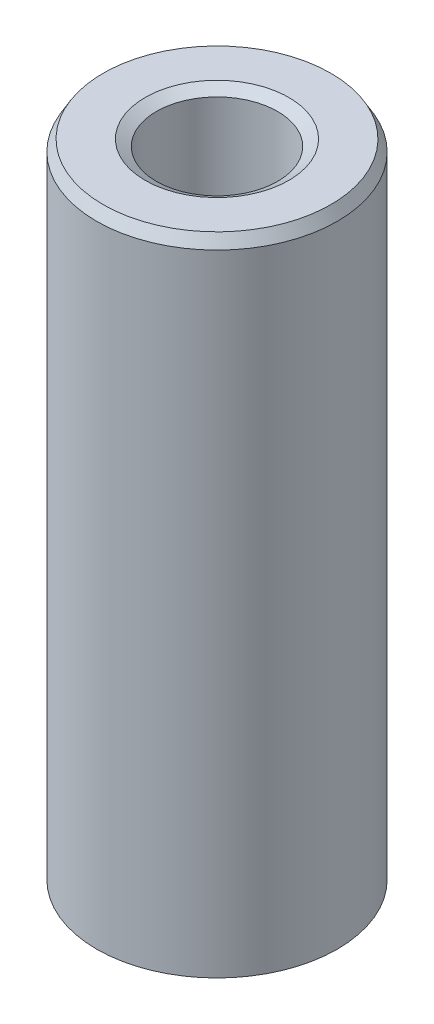
from build123d import *
from OCP.BRepFilletAPI import BRepFilletAPI_MakeChamfer

# Parameters (mm, degrees)
SKETCH1_R           = 10
BOSS_EXTRUDE1_DEPTH = 53.862137515
SKETCH2_R           = 5.038886239
CUT_EXTRUDE1_DEPTH  = 56.687789126
CHAMFER1_SIZE       = 0.932884394
CHAMFER1_SIZE2      = 0.538601056


with BuildPart() as part:
    # Sketch1 → Boss-Extrude1 (new body)
    with BuildSketch(Plane(origin=(0, 0, 0), x_dir=(1, 0, 0), z_dir=(0, 1, 0))):
        Circle(SKETCH1_R)
    extrude(amount=BOSS_EXTRUDE1_DEPTH)

    # Sketch2 → Cut-Extrude1 (cut, through all)
    with BuildSketch(Plane(origin=(0, 0, 0), x_dir=(1, 0, 0), z_dir=(0, 1, 0))):
        Circle(SKETCH2_R)
    extrude(amount=CUT_EXTRUDE1_DEPTH, mode=Mode.SUBTRACT)

    # Chamfer1: one chamfer whose edges measure the first distance from different faces: ONE call of the kernel's chamfer builder (chamfer() names one face for all edges)
    chamfer1_edges_1 = [part.edges().sort_by_distance(p)[0] for p in [
        (-5.038886239, 53.862137515, 0),
    ]]
    chamfer1_side_1 = [part.faces().sort_by_distance(p)[0] for p in [
        (-9.717157288, 53.862137515, 0),
    ]]
    chamfer1_edges_2 = [part.edges().sort_by_distance(p)[0] for p in [
        (-5.038886239, 0, 0),
    ]]
    chamfer1_side_2 = [part.faces().sort_by_distance(p)[0] for p in [
        (-5.038886239, 26.931068758, 0),
    ]]
    chamfer1_edges_3 = [part.edges().sort_by_distance(p)[0] for p in [
        (-10, 0, 0),
    ]]
    chamfer1_side_3 = [part.faces().sort_by_distance(p)[0] for p in [
        (-9.717157288, 0, 0),
    ]]
    chamfer1_edges_4 = [part.edges().sort_by_distance(p)[0] for p in [
        (-10, 53.862137515, 0),
    ]]
    chamfer1_side_4 = [part.faces().sort_by_distance(p)[0] for p in [
        (-10, 26.931068758, 0),
    ]]
    chamfer1 = BRepFilletAPI_MakeChamfer(part.part.solid().wrapped)
    for e in chamfer1_edges_1:
        chamfer1.Add(CHAMFER1_SIZE, CHAMFER1_SIZE2, e.wrapped, chamfer1_side_1[0].wrapped)  # the first distance lies on this face
    for e in chamfer1_edges_2:
        chamfer1.Add(CHAMFER1_SIZE, CHAMFER1_SIZE2, e.wrapped, chamfer1_side_2[0].wrapped)  # the first distance lies on this face
    for e in chamfer1_edges_3:
        chamfer1.Add(CHAMFER1_SIZE, CHAMFER1_SIZE2, e.wrapped, chamfer1_side_3[0].wrapped)  # the first distance lies on this face
    for e in chamfer1_edges_4:
        chamfer1.Add(CHAMFER1_SIZE, CHAMFER1_SIZE2, e.wrapped, chamfer1_side_4[0].wrapped)  # the first distance lies on this face
    add(Compound.cast(chamfer1.Shape()), mode=Mode.REPLACE)


solid = part.part
